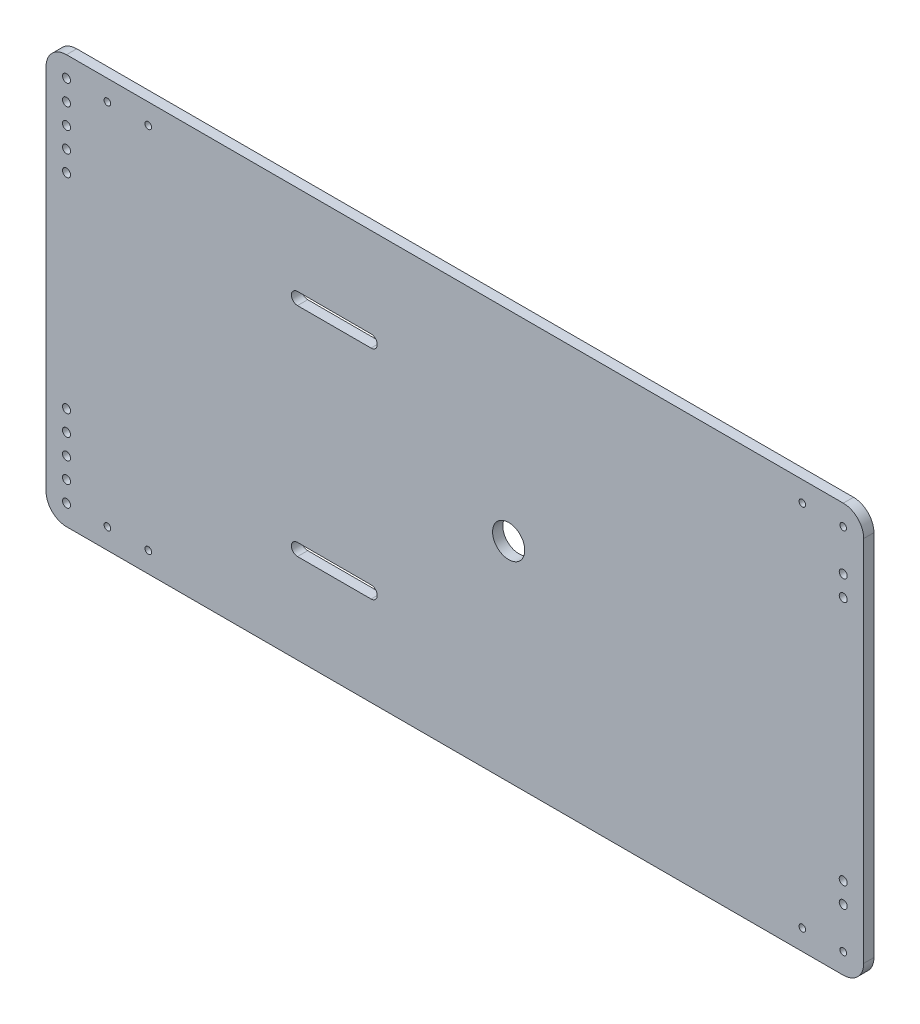
from build123d import *

# Parameters (mm, degrees)
BOSS_EXTRUDE1_DEPTH = 6.35
SKETCH2_R           = 2.5
SKETCH2_R_2         = 2.4892
SKETCH2_R_3         = 2.0701
CUT_EXTRUDE1_DEPTH  = 568.996762755
SKETCH3_R           = 2.0701
SKETCH3_R_2         = 2.4892
CUT_EXTRUDE2_DEPTH  = 568.996762755
CUT_EXTRUDE3_DEPTH  = 568.996762755
SKETCH5_R           = 10
CUT_EXTRUDE4_DEPTH  = 568.996762755


with BuildPart() as part:
    # Sketch1 → Boss-Extrude1 (new body)
    with BuildSketch(Plane.XY):
        with BuildLine():
            Line((12.7, 0), (495.3, 0))
            ThreePointArc((495.3, 0), (504.280256121, 3.719743879), (508, 12.7))
            Line((508, 12.7), (508, 241.3))
            ThreePointArc((508, 241.3), (504.280256121, 250.280256121), (495.3, 254))
            Line((495.3, 254), (12.7, 254))
            ThreePointArc((12.7, 254), (3.719743879, 250.280256121), (0, 241.3))
            Line((0, 241.3), (0, 12.7))
            ThreePointArc((0, 12.7), (3.719743879, 3.719743879), (12.7, 0))
        make_face()
    extrude(amount=BOSS_EXTRUDE1_DEPTH)

    # Sketch2 → Cut-Extrude1 (cut, through all)
    with BuildSketch(Plane.XY.offset(6.35)):
        with Locations((12.7, 190.5)):
            Circle(SKETCH2_R)
        with Locations((12.7, 203.2)):
            Circle(SKETCH2_R)
        with Locations((12.7, 215.9)):
            Circle(SKETCH2_R)
        with Locations((12.7, 228.6)):
            Circle(SKETCH2_R)
        with Locations((12.7, 241.3)):
            Circle(SKETCH2_R_2)
        with Locations((38.1, 241.3)):
            Circle(SKETCH2_R_3)
        with Locations((63.5, 241.3)):
            Circle(SKETCH2_R_3)
        with Locations((63.5, 12.7)):
            Circle(SKETCH2_R_3)
        with Locations((38.1, 12.7)):
            Circle(SKETCH2_R_3)
        with Locations((12.7, 63.5)):
            Circle(SKETCH2_R)
        with Locations((12.7, 50.8)):
            Circle(SKETCH2_R)
        with Locations((12.7, 38.1)):
            Circle(SKETCH2_R)
        with Locations((12.7, 25.4)):
            Circle(SKETCH2_R)
        with Locations((12.7, 12.7)):
            Circle(SKETCH2_R_2)
    extrude(amount=-CUT_EXTRUDE1_DEPTH, mode=Mode.SUBTRACT)

    # Sketch3 → Cut-Extrude2 (cut, through all)
    with BuildSketch(Plane.XY.offset(6.35)):
        with Locations((469.879454624, 241.3)):
            Circle(SKETCH3_R)
        with Locations((495.279454624, 241.3)):
            Circle(SKETCH3_R)
        with Locations((495.279454624, 215.9)):
            Circle(SKETCH3_R_2)
        with Locations((495.279454624, 203.2)):
            Circle(SKETCH3_R_2)
        with Locations((469.879454624, 12.7)):
            Circle(SKETCH3_R)
        with Locations((495.279454624, 12.7)):
            Circle(SKETCH3_R)
        with Locations((495.279454624, 38.1)):
            Circle(SKETCH3_R_2)
        with Locations((495.279454624, 50.8)):
            Circle(SKETCH3_R_2)
    extrude(amount=-CUT_EXTRUDE2_DEPTH, mode=Mode.SUBTRACT)

    # Sketch4 → Cut-Extrude3 (cut, through all)
    with BuildSketch(Plane.XY.offset(6.35)):
        with BuildLine():
            Line((156.21, 198.374), (201.93, 198.374))
            ThreePointArc((201.93, 198.374), (205.74, 194.564), (201.93, 190.754))
            Line((201.93, 190.754), (156.21, 190.754))
            ThreePointArc((156.21, 190.754), (152.4, 194.564), (156.21, 198.374))
        make_face()
        with BuildLine():
            Line((156.21, 63.354), (201.93, 63.354))
            ThreePointArc((201.93, 63.354), (205.74, 59.544), (201.93, 55.734))
            Line((201.93, 55.734), (156.21, 55.734))
            ThreePointArc((156.21, 55.734), (152.4, 59.544), (156.21, 63.354))
        make_face()
    extrude(amount=-CUT_EXTRUDE3_DEPTH, mode=Mode.SUBTRACT)

    # Sketch5 → Cut-Extrude4 (cut, through all)
    with BuildSketch(Plane.XY.offset(6.35)):
        with Locations((287.406455552, 129.657331692)):
            Circle(SKETCH5_R)
    extrude(amount=-CUT_EXTRUDE4_DEPTH, mode=Mode.SUBTRACT)


solid = part.part
